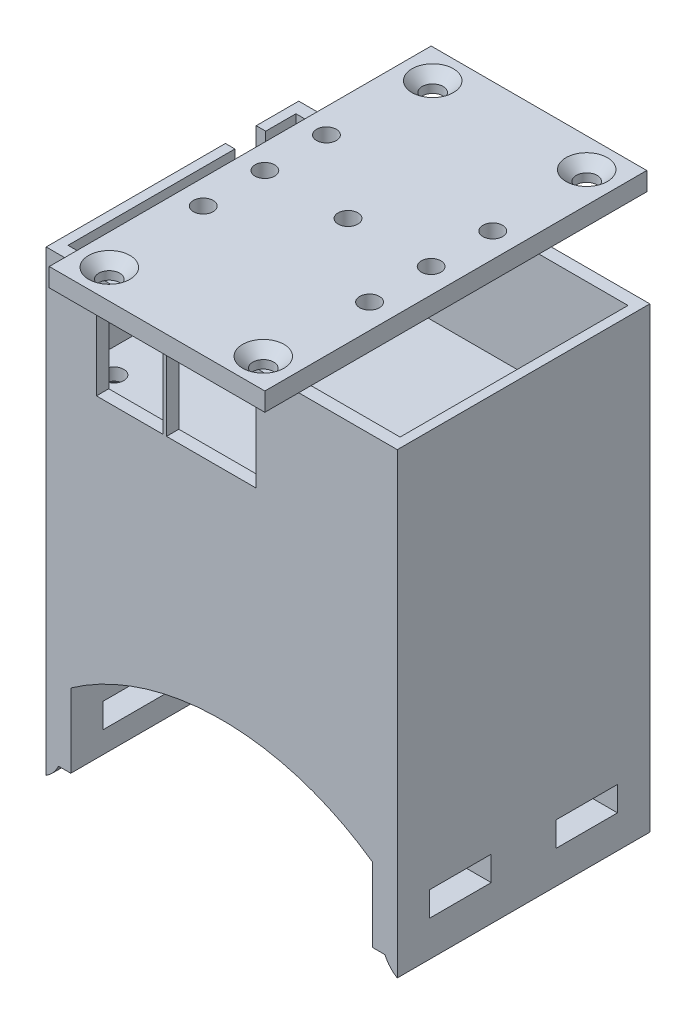
from build123d import *

# Parameters (mm, degrees)
SKETCH_2_W           = 57
SKETCH_2_H           = 41
EXTRUDE_1_DEPTH      = 2
SKETCH_1_R           = 1.6
CUT_EXTRUDE_1_DEPTH  = 2
SKETCH_4_W           = 57
SKETCH_4_H           = 41
SKETCH_4_W_2         = 53.914285714
SKETCH_4_H_2         = 37
EXTRUDE_2_DEPTH      = 20
SKETCH_5_W           = 10.8
SKETCH_5_H           = 13
SKETCH_5_H_2         = 2
SKETCH_5_W_2         = 14.5
CUT_EXTRUDE_2_DEPTH  = 18.5
EXTRUDE_START        = 25
SKETCH_6_W           = 35
SKETCH_6_H           = 62
EXTRUDE_3_DEPTH      = 3
SKETCH_8_W           = 5
SKETCH_8_H           = 5
CUT_EXTRUDE_6_DEPTH  = 10
SKETCH_9_W           = 57
SKETCH_9_H           = 41
EXTRUDE_4_DEPTH      = 40
SKETCH_10_R          = 1.4
CUT_EXTRUDE_7_DEPTH  = 10
SKETCH_12_W          = 8
SKETCH_12_H          = 41
EXTRUDE_5_DEPTH      = 15
SKETCH_13_W          = 4
SKETCH_13_H          = 41
CUT_EXTRUDE_8_DEPTH  = 15
SKETCH_14_W          = 2
SKETCH_14_H          = 41
CUT_EXTRUDE_9_DEPTH  = 3
SKETCH_15_W          = 10
SKETCH_15_H          = 4
CUT_EXTRUDE_10_DEPTH = 86.058803189
CUT_EXTRUDE_12_DEPTH = 81.557432928
FILLET_1_R           = 5
F_3_0MM_START        = 25
F_3_0MM_1_OUTLINE_R  = 1.6
F_3_0MM_1_DEPTH      = 3


# Read off the part's stored shape, not the designer's step: M3 六角凹锥坑螺钉的锥形沉头孔1, Ø3.0mm 暗销孔1
with BuildPart() as part:
    # 草图2 → 凸台-拉伸1 (new body)
    with BuildSketch(Plane(origin=(0, 0, 0), x_dir=(1, 0, 0), z_dir=(0, 1, 0))):
        Rectangle(SKETCH_2_W, SKETCH_2_H)
    extrude(amount=EXTRUDE_1_DEPTH)

    # 草图1 → 切除-拉伸1 (cut)
    with BuildSketch(Plane(origin=(0, 0, 0), x_dir=(1, 0, 0), z_dir=(0, 1, 0))):
        with Locations(Location((-23, 15, 0), (0, 0, 270))):
            Circle(SKETCH_1_R)
        with Locations(Location((-23, -15, 0), (0, 0, 270))):
            Circle(SKETCH_1_R)
        with Locations(Location((23, -15, 0), (0, 0, 270))):
            Circle(SKETCH_1_R)
        with Locations(Location((23, 15, 0), (0, 0, 270))):
            Circle(SKETCH_1_R)
    extrude(amount=CUT_EXTRUDE_1_DEPTH, mode=Mode.SUBTRACT)

    # 草图4 → 凸台-拉伸2 (add)
    with BuildSketch(Plane(origin=(0, 0, 0), x_dir=(1, 0, 0), z_dir=(0, 1, 0))):
        Rectangle(SKETCH_4_W, SKETCH_4_H)
        Rectangle(SKETCH_4_W_2, SKETCH_4_H_2, mode=Mode.SUBTRACT)
    extrude(amount=EXTRUDE_2_DEPTH)

    # 草图5 → 切除-拉伸2 (cut)
    with BuildSketch(Plane.XY.offset(20.5)):
        with Locations((-14.939380763, 9.639146882)):
            Rectangle(SKETCH_5_W, SKETCH_5_H)
        with Locations((-14.939380763, 17.139146882)):
            Rectangle(SKETCH_5_W, SKETCH_5_H_2)
        with Locations((-1.710619237, 9.639146882)):
            Rectangle(SKETCH_5_W_2, SKETCH_5_H)
        with Locations((-1.710619237, 17.139146882)):
            Rectangle(SKETCH_5_W_2, SKETCH_5_H_2)
    extrude(amount=-CUT_EXTRUDE_2_DEPTH, mode=Mode.SUBTRACT)

    # 草图8 → 切除-拉伸6 (cut)
    with BuildSketch(Plane.ZY.offset(28.5)):
        with Locations((-11.098227415, 17.5)):
            Rectangle(SKETCH_8_W, SKETCH_8_H)
    extrude(amount=-CUT_EXTRUDE_6_DEPTH, mode=Mode.SUBTRACT)

    # 草图9 → 凸台-拉伸4 (add)
    with BuildSketch(Plane.XZ):
        Rectangle(SKETCH_9_W, SKETCH_9_H)
    extrude(amount=EXTRUDE_4_DEPTH)

    # 草图10 → 切除-拉伸7 (cut)
    with BuildSketch(Plane(origin=(0, 2, 0), x_dir=(1, 0, 0), z_dir=(0, 1, 0))):
        with Locations(Location((-23, 15, 0), (0, 0, 270))):
            Circle(SKETCH_10_R)
        with Locations(Location((-23, -15, 0), (0, 0, 270))):
            Circle(SKETCH_10_R)
        with Locations(Location((23, -15, 0), (0, 0, 270))):
            Circle(SKETCH_10_R)
        with Locations(Location((23, 15, 0), (0, 0, 270))):
            Circle(SKETCH_10_R)
    extrude(amount=-CUT_EXTRUDE_7_DEPTH, mode=Mode.SUBTRACT)

    # 草图12 → 凸台-拉伸5 (add)
    with BuildSketch(Plane.XZ.offset(40)):
        with Locations((-24.5, 0)):
            Rectangle(SKETCH_12_W, SKETCH_12_H)
        with Locations((24.5, 0)):
            Rectangle(SKETCH_12_W, SKETCH_12_H)
    extrude(amount=EXTRUDE_5_DEPTH)

    # 草图13 → 切除-拉伸8 (cut)
    with BuildSketch(Plane.XZ.offset(55)):
        with Locations((-22.5, 0)):
            Rectangle(SKETCH_13_W, SKETCH_13_H)
        with Locations((22.5, 0)):
            Rectangle(SKETCH_13_W, SKETCH_13_H)
    extrude(amount=-CUT_EXTRUDE_8_DEPTH, mode=Mode.SUBTRACT)

    # 草图14 → 切除-拉伸9 (cut)
    with BuildSketch(Plane.XZ.offset(55)):
        with Locations((-25.5, 0)):
            Rectangle(SKETCH_14_W, SKETCH_14_H)
        with Locations((25.5, 0)):
            Rectangle(SKETCH_14_W, SKETCH_14_H)
    extrude(amount=-CUT_EXTRUDE_9_DEPTH, mode=Mode.SUBTRACT)

    # 草图15 → 切除-拉伸10 (cut, through all)
    with BuildSketch(Plane.ZY.offset(28.5)):
        with Locations((-10.25, -46.939346002)):
            Rectangle(SKETCH_15_W, SKETCH_15_H)
        with Locations((10.25, -46.496240266)):
            Rectangle(SKETCH_15_W, SKETCH_15_H)
    extrude(amount=-CUT_EXTRUDE_10_DEPTH, mode=Mode.SUBTRACT)

    # 草图19 → 切除-拉伸12 (cut, through all)
    with BuildSketch(Plane(origin=(0, 0, -20.5), x_dir=(-1, 0, 0), z_dir=(0, 0, -1))):
        with BuildLine():
            ThreePointArc((24.5, -40), (0, -32.224551533), (-24.5, -40))
            Line((-24.5, -40), (24.5, -40))
        make_face()
    extrude(amount=-CUT_EXTRUDE_12_DEPTH, mode=Mode.SUBTRACT)

    # 圆角1
    # the kernel refuses this fillet: 5 mm, written as the material it takes off along each edge
    with BuildSketch(Plane(origin=(26.5, -55, 31.956439237), x_dir=(0, 1, 0), z_dir=(0, 0, -1))) as fillet_1_piece_1:
        with BuildLine():
            CenterArc((5, 4.582575695), FILLET_1_R, 180, 66.421821522)
            Line((0, 4.582575695), (-0.1, 4.582575695))
            Line((-0.1, 4.582575695), (-0.1, 0))
            Line((-0.1, 0), (0, -0.1))
            ThreePointArc((0, -0.1), (1.5, -0.1), (2.96, -0.091651514))
            Line((2.96, -0.091651514), (3, 0))
        make_face()
    extrude(amount=63.912878475, mode=Mode.SUBTRACT)
    with BuildSketch(Plane(origin=(-26.5, -55, 31.956439237), x_dir=(0, 1, 0), z_dir=(0, 0, -1))) as fillet_1_piece_2:
        with BuildLine():
            CenterArc((5, -4.582575695), FILLET_1_R, 113.578178478, 66.421821522)
            Line((0, -4.582575695), (-0.1, -4.582575695))
            Line((-0.1, -4.582575695), (-0.1, 0))
            Line((-0.1, 0), (0, 0.1))
            ThreePointArc((0, 0.1), (1.5, 0.1), (2.96, 0.091651514))
            Line((2.96, 0.091651514), (3, 0))
        make_face()
    extrude(amount=63.912878475, mode=Mode.SUBTRACT)


with BuildPart() as body_2:
    # 草图6 → 凸台-拉伸3 (new body)
    with BuildSketch(Plane(origin=(0, 0, 0), x_dir=(1, 0, 0), z_dir=(0, 1, 0)).offset(EXTRUDE_START)):
        Rectangle(SKETCH_6_W, SKETCH_6_H)
    extrude(amount=EXTRUDE_3_DEPTH)

    # M3 六角凹锥坑螺钉的锥形沉头孔1 outline → M3 六角凹锥坑螺钉的锥形沉头孔1 (revolve, cut)
    with BuildSketch(Plane(origin=(-12.5, 0, -26.25), x_dir=(1, 0, 0), z_dir=(0, 0, 1))):
        Polygon((0, 25), (1.7, 25), (1.7, 26.34), (3.36, 28), (0, 28), align=None)
    revolve(axis=Axis((-12.5, 0, -26.25), (0, 1, 0)), mode=Mode.SUBTRACT)

    # Hole Wizard M3 _1 2 outline → Hole Wizard M3 _1 2 (revolve, cut)
    with BuildSketch(Plane(origin=(12.5, 0, 26.25), x_dir=(1, 0, 0), z_dir=(0, 0, 1))):
        Polygon((0, 25), (1.7, 25), (1.7, 26.34), (3.36, 28), (0, 28), align=None)
    revolve(axis=Axis((12.5, 0, 26.25), (0, 1, 0)), mode=Mode.SUBTRACT)

    # Hole Wizard M3 _1 3 outline → Hole Wizard M3 _1 3 (revolve, cut)
    with BuildSketch(Plane(origin=(12.5, 0, -26.25), x_dir=(1, 0, 0), z_dir=(0, 0, 1))):
        Polygon((0, 25), (1.7, 25), (1.7, 26.34), (3.36, 28), (0, 28), align=None)
    revolve(axis=Axis((12.5, 0, -26.25), (0, 1, 0)), mode=Mode.SUBTRACT)

    # Hole Wizard M3 _1 4 outline → Hole Wizard M3 _1 4 (revolve, cut)
    with BuildSketch(Plane(origin=(-12.5, 0, 26.25), x_dir=(1, 0, 0), z_dir=(0, 0, 1))):
        Polygon((0, 25), (1.7, 25), (1.7, 26.34), (3.36, 28), (0, 28), align=None)
    revolve(axis=Axis((-12.5, 0, 26.25), (0, 1, 0)), mode=Mode.SUBTRACT)

    # Ø3.0mm 暗销孔1 outline → Ø3.0mm 暗销孔1 (cut)
    with BuildSketch(Plane(origin=(0, 0, 0), x_dir=(1, 0, 0), z_dir=(0, 1, 0)).offset(F_3_0MM_START)):
        with Locations((-13.5, 0)):
            Circle(F_3_0MM_1_OUTLINE_R)
        with Locations((13.5, 0)):
            Circle(F_3_0MM_1_OUTLINE_R)
        with Locations((-13.5, -10)):
            Circle(F_3_0MM_1_OUTLINE_R)
        with Locations((13.5, 10)):
            Circle(F_3_0MM_1_OUTLINE_R)
        with Locations((13.5, -10)):
            Circle(F_3_0MM_1_OUTLINE_R)
        with Locations((-13.5, 10)):
            Circle(F_3_0MM_1_OUTLINE_R)
        Circle(F_3_0MM_1_OUTLINE_R)
    extrude(amount=F_3_0MM_1_DEPTH, mode=Mode.SUBTRACT)


solid = Compound([part.part, body_2.part])
